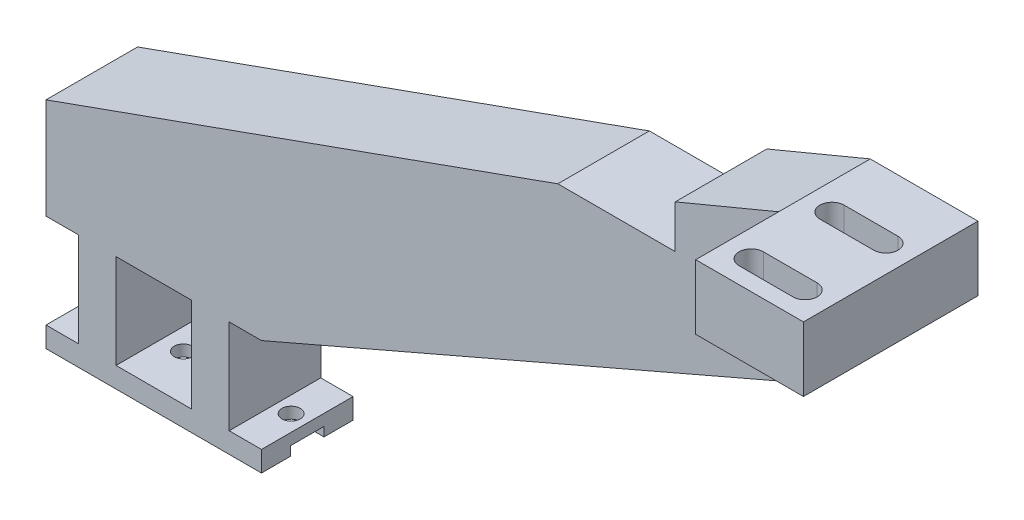
from build123d import *
from build123d.topology import SkipClean

# Parameters (mm, degrees)
EXTRUDE_1_DEPTH          = 8.5
SKETCH_2_W               = 6.2
SKETCH_2_H               = 6.2
CUT_EXTRUDE_1_DEPTH      = 1.7
SKETCH_3_W               = 6
SKETCH_3_H               = 17.5
SKETCH_3_W_2             = 14
CUT_EXTRUDE_2_DEPTH      = 164.966459985
HOLE_WIZARD_M3_1_D       = 3.4
HOLE_WIZARD_M3_1_DEPTH   = 5
HOLE_WIZARD_M3_1_TIP     = 1.021463052
SKETCH_6_W               = 20
SKETCH_6_H               = 12
EXTRUDE_2_DEPTH          = 15.4
HOLE_START               = 85
HOLE_WIZARD_M4_1_DEPTH   = 5
HOLE_START_2             = 121
HOLE_WIZARD_M4_1_2_DEPTH = 10


with BuildPart() as part:
    # 스케치1 → 보스-돌출1 (new, symmetric)
    with BuildSketch(Plane.XY):
        Polygon((20, 0), (-20, 0), (-20, 40), (75, 74), (96.8, 74), (96.8, 82), (116, 90), (136, 90), (136, 78), (116, 78), (116, 62.8), (20, 21.3), align=None)
    extrude(amount=EXTRUDE_1_DEPTH, both=True)

    # 스케치2 → 컷-돌출1 (cut)
    with BuildSketch(Plane(origin=(0, 0, 0), x_dir=(-1, 0, 0), z_dir=(0, -1, 0))):
        with Locations((-3.1, 0)):
            Rectangle(SKETCH_2_W, SKETCH_2_H)
        with Locations((-16.9, 0)):
            Rectangle(SKETCH_2_W, SKETCH_2_H)
    cut_extrude_1 = extrude(amount=-CUT_EXTRUDE_1_DEPTH, mode=Mode.SUBTRACT)

    # 대칭 복사1: 컷-돌출1 across plane
    add(cut_extrude_1.mirror(Plane(origin=(0, 0, 0), x_dir=(0, 0, 1), z_dir=(1, 0, 0))), mode=Mode.SUBTRACT)

    # 스케치3 → 컷-돌출2 (cut, through all)
    with BuildSketch(Plane(origin=(0, 0, -8.5), x_dir=(-1, 0, 0), z_dir=(0, 0, -1))):
        with Locations((-17, 12.55)):
            Rectangle(SKETCH_3_W, SKETCH_3_H)
        with Locations((0, 12.55)):
            Rectangle(SKETCH_3_W_2, SKETCH_3_H)
        with Locations((17, 12.55)):
            Rectangle(SKETCH_3_W, SKETCH_3_H)
    extrude(amount=-CUT_EXTRUDE_2_DEPTH, mode=Mode.SUBTRACT)

    # M3 여유 구멍1
    with Locations(Plane(origin=(0, 1.7, 0), x_dir=(-1, 0, 0), z_dir=(0, -1, 0))):
        with Locations((17, 0), (3, 0), (-3, 0), (-17, 0)):
            Hole(HOLE_WIZARD_M3_1_D / 2, depth=HOLE_WIZARD_M3_1_DEPTH)
            with Locations((0, 0, -(HOLE_WIZARD_M3_1_DEPTH + HOLE_WIZARD_M3_1_TIP / 2))):  # 118° drill point
                Cone(0, HOLE_WIZARD_M3_1_D / 2, HOLE_WIZARD_M3_1_TIP, mode=Mode.SUBTRACT)

    # 스케치6 → 보스-돌출2 (add)
    with BuildSketch(Plane.XY.offset(8.5)):
        with Locations((126, 84)):
            Rectangle(SKETCH_6_W, SKETCH_6_H)
    extrude(amount=EXTRUDE_2_DEPTH)

    # M4 여유 홈1: read off the stored shape, not the designer's step
    # M4 여유 홈1 outline → M4 여유 홈1 (cut)
    with BuildSketch(Plane(origin=(0, 0, 0), x_dir=(1, 0, 0), z_dir=(0, 1, 0)).offset(HOLE_START)):
        with BuildLine():
            Line((121, -5.85), (131, -5.85))
            ThreePointArc((131, -5.85), (133.25, -3.6), (131, -1.35))
            Line((131, -1.35), (121, -1.35))
            ThreePointArc((121, -1.35), (118.75, -3.6), (121, -5.85))
        make_face()
        with BuildLine():
            Line((121, -20.85), (131, -20.85))
            ThreePointArc((131, -20.85), (133.25, -18.6), (131, -16.35))
            Line((131, -16.35), (121, -16.35))
            ThreePointArc((121, -16.35), (118.75, -18.6), (121, -20.85))
        make_face()
    extrude(amount=HOLE_WIZARD_M4_1_DEPTH, mode=Mode.SUBTRACT)

    # Hole Wizard M4 _ _1 2 outline → Hole Wizard M4 _ _1 2 (cut)
    with BuildSketch(Plane.YZ.offset(HOLE_START_2)):
        Polygon((85, 5.85), (83.648063607, 3.6), (85, 1.35), align=None)
        Polygon((85, 20.85), (83.648063607, 18.6), (85, 16.35), align=None)
    extrude(amount=HOLE_WIZARD_M4_1_2_DEPTH, mode=Mode.SUBTRACT)

    # Hole Wizard M4 _ _1 3 outline → Hole Wizard M4 _ _1 3 (revolve, cut)
    with SkipClean():  # the faces are left unmerged after this step: merging them gives an invalid solid
        with BuildSketch(Plane(origin=(131, 0, 3.6), x_dir=(1, 0, 0), z_dir=(0, 0, 1))):
            Polygon((0, 85), (0, 83.648063607), (2.25, 85), align=None)
        revolve(axis=Axis((131, 0, 3.6), (0, 1, 0)), mode=Mode.SUBTRACT)

    # Hole Wizard M4 _ _1 4 outline → Hole Wizard M4 _ _1 4 (revolve, cut)
    with SkipClean():  # the faces are left unmerged after this step: merging them gives an invalid solid
        with BuildSketch(Plane(origin=(121, 0, 3.6), x_dir=(1, 0, 0), z_dir=(0, 0, 1))):
            Polygon((0, 85), (0, 83.648063607), (2.25, 85), align=None)
        revolve(axis=Axis((121, 0, 3.6), (0, 1, 0)), mode=Mode.SUBTRACT)

    # Hole Wizard M4 _ _1 5 outline → Hole Wizard M4 _ _1 5 (revolve, cut)
    with SkipClean():  # the faces are left unmerged after this step: merging them gives an invalid solid
        with BuildSketch(Plane(origin=(131, 0, 18.6), x_dir=(1, 0, 0), z_dir=(0, 0, 1))):
            Polygon((0, 85), (0, 83.648063607), (2.25, 85), align=None)
        revolve(axis=Axis((131, 0, 18.6), (0, 1, 0)), mode=Mode.SUBTRACT)

    # Hole Wizard M4 _ _1 6 outline → Hole Wizard M4 _ _1 6 (revolve, cut)
    with SkipClean():  # the faces are left unmerged after this step: merging them gives an invalid solid
        with BuildSketch(Plane(origin=(121, 0, 18.6), x_dir=(1, 0, 0), z_dir=(0, 0, 1))):
            Polygon((0, 85), (0, 83.648063607), (2.25, 85), align=None)
        revolve(axis=Axis((121, 0, 18.6), (0, 1, 0)), mode=Mode.SUBTRACT)


solid = part.part
